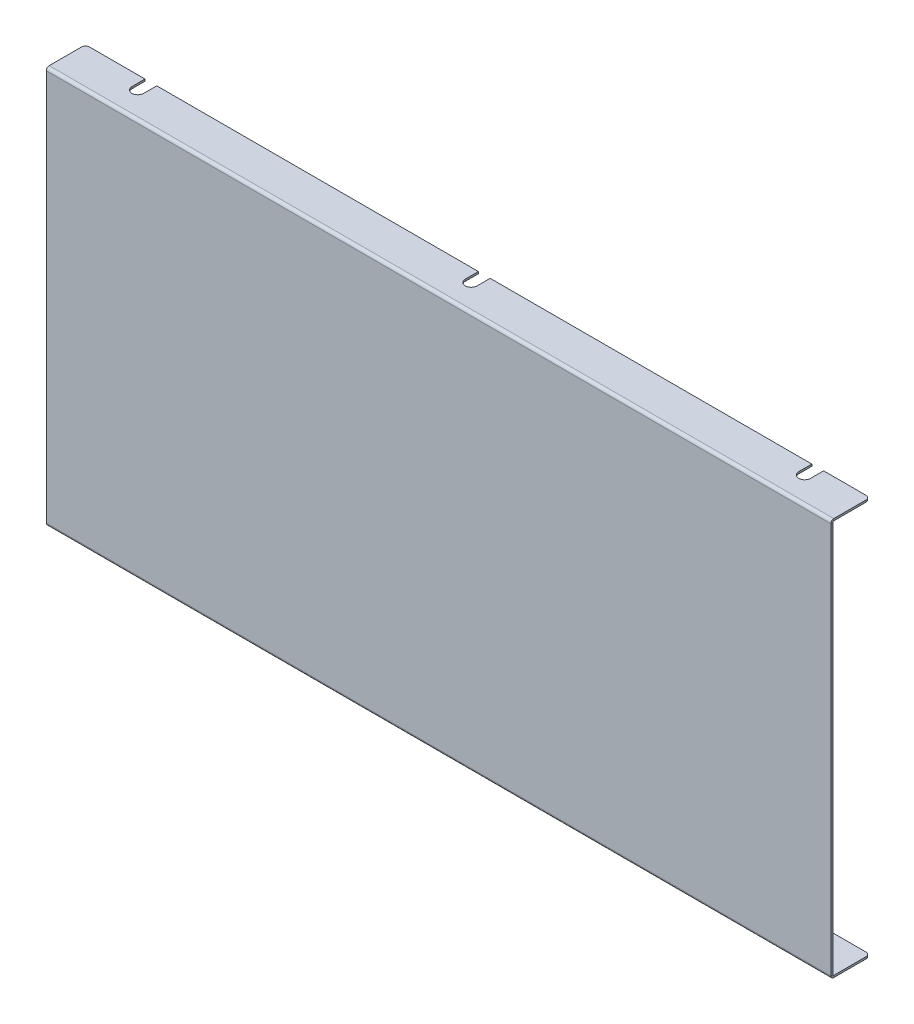
from build123d import *

# Parameters (mm, degrees)
SKETCH_1_W                         = 600
SKETCH_1_H                         = 304
SM_BASE_FLANGE_1_DEPTH             = 1.5
SM_EDGE_FLANGE_1_STRIP_W           = 7.4732
SM_EDGE_FLANGE_1_STRIP_H           = 1.5
SM_EDGE_FLANGE_1_STRIP_CUT_DEPTH   = 600
SM_EDGE_FLANGE_1_STRIP_2_W         = 7.4732
SM_EDGE_FLANGE_1_STRIP_2_H         = 1.5
SM_EDGE_FLANGE_1_STRIP_CUT_2_DEPTH = 600
SM_EDGE_FLANGE_1_DEPTH             = 600
SM_EDGE_FLANGE_1_BEND_DEPTH        = 600
OTHER_START                        = -152
OTHER_1_DEPTH                      = 304
CUT_EXTRUDE_1_DEPTH                = 429.154177838
PATTERN_LINEAR_1_COUNT             = 3
PATTERN_LINEAR_1_PITCH             = 255


# Read off the part's stored shape, not the designer's step: 断开-边角1
# Sheet-metal steps are written as plain solids
with BuildPart() as part:
    # Sketch 1 → 基体-法兰1 (new body)
    with BuildSketch(Plane.XY):
        Rectangle(SKETCH_1_W, SKETCH_1_H)
    extrude(amount=-SM_BASE_FLANGE_1_DEPTH)

    # 边线-法兰1 strip (across the edge) → 边线-法兰1 strip cut (cut)
    with BuildSketch(Plane(origin=(300, -152, -1.5), x_dir=(0, 1, 0), z_dir=(-1, 0, 0))):
        with Locations((-1.5, -0.75)):
            Rectangle(SM_EDGE_FLANGE_1_STRIP_W, SM_EDGE_FLANGE_1_STRIP_H)
    extrude(amount=SM_EDGE_FLANGE_1_STRIP_CUT_DEPTH, mode=Mode.SUBTRACT)

    # 边线-法兰1 strip 2 (across the edge) → 边线-法兰1 strip cut 2 (cut)
    with BuildSketch(Plane(origin=(-300, 152, -1.5), x_dir=(0, -1, 0), z_dir=(1, 0, 0))):
        with Locations((-1.5, -0.75)):
            Rectangle(SM_EDGE_FLANGE_1_STRIP_2_W, SM_EDGE_FLANGE_1_STRIP_2_H)
    extrude(amount=SM_EDGE_FLANGE_1_STRIP_CUT_2_DEPTH, mode=Mode.SUBTRACT)

    # 边线-法兰1 section (across the edge) → 边线-法兰1 (add)
    with BuildSketch(Plane(origin=(300, -152, -1.5), x_dir=(0, 1, 0), z_dir=(-1, 0, 0))):
        with BuildLine():
            Line((0, 0.7366), (0, 28.5))
            Line((0, 28.5), (1.5, 28.5))
            Line((1.5, 28.5), (1.5, 0.7366))
            ThreePointArc((1.5, 0.7366), (1.715745145, 0.215745145), (2.2366, 0))
            Line((2.2366, 0), (2.2366, -1.5))
            ThreePointArc((2.2366, -1.5), (0.655084973, -0.844915027), (0, 0.7366))
        make_face()
    extrude(amount=SM_EDGE_FLANGE_1_DEPTH)

    # 边线-法兰1 section 2 (across the edge) → 边线-法兰1 bend (add)
    with BuildSketch(Plane(origin=(-300, 152, -1.5), x_dir=(0, -1, 0), z_dir=(1, 0, 0))):
        with BuildLine():
            Line((0, 0.7366), (0, 28.5))
            Line((0, 28.5), (1.5, 28.5))
            Line((1.5, 28.5), (1.5, 0.7366))
            ThreePointArc((1.5, 0.7366), (1.715745145, 0.215745145), (2.2366, 0))
            Line((2.2366, 0), (2.2366, -1.5))
            ThreePointArc((2.2366, -1.5), (0.655084973, -0.844915027), (0, 0.7366))
        make_face()
    extrude(amount=SM_EDGE_FLANGE_1_BEND_DEPTH)

    # Other 1 outline → Other 1 (cut)
    with BuildSketch(Plane(origin=(0, 0, 0), x_dir=(1, 0, 0), z_dir=(0, 1, 0)).offset(OTHER_START)):
        with BuildLine():
            Line((-300, 30), (-300, 27))
            ThreePointArc((-300, 27), (-299.121320344, 29.121320344), (-297, 30))
            Line((-297, 30), (-300, 30))
        make_face()
        with BuildLine():
            Line((300, 30), (297, 30))
            ThreePointArc((297, 30), (299.121320344, 29.121320344), (300, 27))
            Line((300, 27), (300, 30))
        make_face()
    extrude(amount=OTHER_1_DEPTH, mode=Mode.SUBTRACT)

    # 草图12 → 切除-拉伸1 (cut, symmetric)
    with BuildSketch(Plane.XZ.offset(152)):
        with BuildLine():
            Line((-254.5, -30), (-254.5, -20))
            ThreePointArc((-254.5, -20), (-250, -15.5), (-245.5, -20))
            Line((-245.5, -20), (-245.5, -30))
            ThreePointArc((-245.5, -30), (-250, -34.5), (-254.5, -30))
        make_face()
    cut_extrude_1 = extrude(amount=CUT_EXTRUDE_1_DEPTH, both=True, mode=Mode.SUBTRACT)

    # 阵列(线性)1: 切除-拉伸1 ×3
    with Locations(*[(i * PATTERN_LINEAR_1_PITCH, 0, 0) for i in range(1, PATTERN_LINEAR_1_COUNT)]):
        add(cut_extrude_1, mode=Mode.SUBTRACT)


solid = part.part
